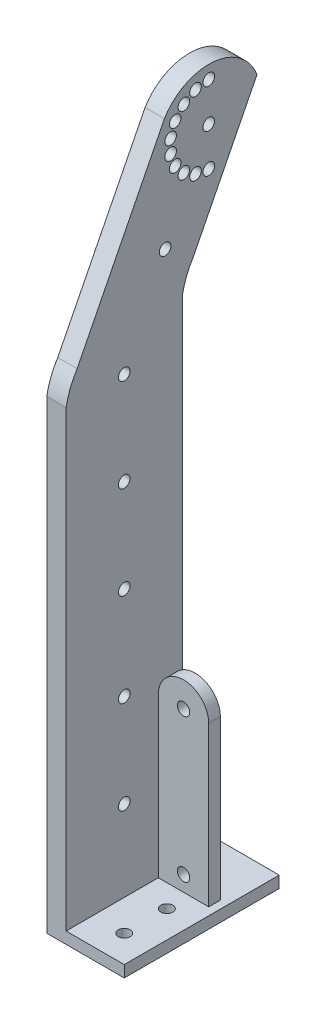
from build123d import *

# Parameters (mm, degrees)
SKETCH_1_R          = 1.5
EXTRUDE_2_DEPTH     = 5
CUT_EXTRUDE_2_DEPTH = 1
EXTRUDE_3_DEPTH     = 3
SKETCH_5_R          = 1.55
CUT_EXTRUDE_3_DEPTH = 10
SKETCH_6_W          = 3
SKETCH_6_H          = 41
EXTRUDE_4_DEPTH     = 13
EXTRUDE_5_DEPTH     = 3
SKETCH_9_R          = 1.6
CUT_EXTRUDE_4_DEPTH = 3


with BuildPart() as part:
    # 草图1 → 凸台-拉伸2 (new body)
    with BuildSketch(Plane(origin=(0, 0, 0), x_dir=(0, 0, -1), z_dir=(1, 0, 0))):
        with BuildLine():
            Line((-15, 0), (15, 0))
            Line((15, 0), (15, 130))
            ThreePointArc((15, 130), (16.060667235, 133.763397528), (17.833287426, 137.248507798))
            Line((17.833287426, 137.248507798), (34.277601095, 169.80605943))
            ThreePointArc((34.277601095, 169.80605943), (22.969406924, 178.256928012), (10.37531975, 171.878730504))
            Line((10.37531975, 171.878730504), (-12.166712574, 127.248507798))
            ThreePointArc((-12.166712574, 127.248507798), (-13.939332765, 123.763397528), (-15, 120))
            Line((-15, 120), (-15, 0))
        make_face()
        with Locations((0, 23.934052351)):
            Circle(SKETCH_1_R, mode=Mode.SUBTRACT)
        with Locations((0, 47.934052351)):
            Circle(SKETCH_1_R, mode=Mode.SUBTRACT)
        with Locations((0, 71.934052351)):
            Circle(SKETCH_1_R, mode=Mode.SUBTRACT)
        with Locations((0, 95.934052351)):
            Circle(SKETCH_1_R, mode=Mode.SUBTRACT)
        with Locations((10.541707006, 142.602806473)):
            Circle(SKETCH_1_R, mode=Mode.SUBTRACT)
        with Locations((0, 119.934052351)):
            Circle(SKETCH_1_R, mode=Mode.SUBTRACT)
        with Locations((21.812723168, 164.917917825)):
            Circle(SKETCH_1_R, mode=Mode.SUBTRACT)
        with Locations((11.964645637, 166.654399602)):
            Circle(SKETCH_1_R, mode=Mode.SUBTRACT)
        with Locations((11.964645637, 163.181436049)):
            Circle(SKETCH_1_R, mode=Mode.SUBTRACT)
        with Locations((13.15246913, 159.917917825)):
            Circle(SKETCH_1_R, mode=Mode.SUBTRACT)
        with Locations((15.384847071, 157.257473394)):
            Circle(SKETCH_1_R, mode=Mode.SUBTRACT)
        with Locations((21.812723168, 154.917917825)):
            Circle(SKETCH_1_R, mode=Mode.SUBTRACT)
        with Locations((18.392521734, 155.520991617)):
            Circle(SKETCH_1_R, mode=Mode.SUBTRACT)
        with Locations((13.15246913, 169.917917825)):
            Circle(SKETCH_1_R, mode=Mode.SUBTRACT)
        with Locations((15.384847071, 172.578362256)):
            Circle(SKETCH_1_R, mode=Mode.SUBTRACT)
        with Locations((18.392521734, 174.314844033)):
            Circle(SKETCH_1_R, mode=Mode.SUBTRACT)
        with Locations((21.812723168, 174.917917825)):
            Circle(SKETCH_1_R, mode=Mode.SUBTRACT)
    extrude(amount=-EXTRUDE_2_DEPTH)

    # 草图3 → 切除-拉伸2 (cut)
    with BuildSketch(Plane.ZY.offset(5)):
        with BuildLine():
            Line((-10, 5), (10, 5))
            Line((10, 5), (10, 119.524724411))
            ThreePointArc((10, 119.524724411), (9.161705076, 122.242477333), (7.82549521, 124.753147068))
            Line((7.82549521, 124.753147068), (-14.73885303, 169.427552317))
            ThreePointArc((-14.73885303, 169.427552317), (-21.607154469, 173.304465594), (-28.657153069, 169.768713769))
            Line((-28.657153069, 169.768713769), (-13.477541954, 139.715104809))
            ThreePointArc((-13.477541954, 139.715104809), (-11.272736422, 135.241025308), (-10, 130.418298195))
            Line((-10, 130.418298195), (-10, 5))
        make_face()
    extrude(amount=-CUT_EXTRUDE_2_DEPTH, mode=Mode.SUBTRACT)

    # 草图4 → 凸台-拉伸3 (add)
    with BuildSketch(Plane(origin=(0, 0, 0), x_dir=(-1, 0, 0), z_dir=(0, -1, 0))):
        Polygon((5, -15), (-15, -15), (-15, 25), (8, 25), (8, 15), (5, 15), align=None)
    extrude(amount=-EXTRUDE_3_DEPTH)

    # 草图5 → 切除-拉伸3 (cut)
    with BuildSketch(Plane.XZ):
        with Locations((8, 8)):
            Circle(SKETCH_5_R)
        with Locations((-3, -20)):
            Circle(SKETCH_5_R)
        with Locations((8, -3)):
            Circle(SKETCH_5_R)
    extrude(amount=-CUT_EXTRUDE_3_DEPTH, mode=Mode.SUBTRACT)

    # 草图6 → 凸台-拉伸4 (add)
    with BuildSketch(Plane(origin=(0, 0, 0), x_dir=(0, 0, -1), z_dir=(1, 0, 0))):
        with Locations((10.3, 23.5)):
            Rectangle(SKETCH_6_W, SKETCH_6_H)
    extrude(amount=EXTRUDE_4_DEPTH)

    # 草图8 → 凸台-拉伸5 (add)
    with BuildSketch(Plane(origin=(0, 0, -11.8), x_dir=(-1, 0, 0), z_dir=(0, 0, -1))):
        with BuildLine():
            Line((-13, 44), (0, 44))
            ThreePointArc((0, 44), (-6.5, 50.5), (-13, 44))
        make_face()
    extrude(amount=-EXTRUDE_5_DEPTH)

    # 草图9 → 切除-拉伸4 (cut)
    with BuildSketch(Plane(origin=(0, 0, -11.8), x_dir=(-1, 0, 0), z_dir=(0, 0, -1))):
        with Locations((-6.5, 44)):
            Circle(SKETCH_9_R)
        with Locations((-6.5, 7)):
            Circle(SKETCH_9_R)
    extrude(amount=-CUT_EXTRUDE_4_DEPTH, mode=Mode.SUBTRACT)


solid = part.part
